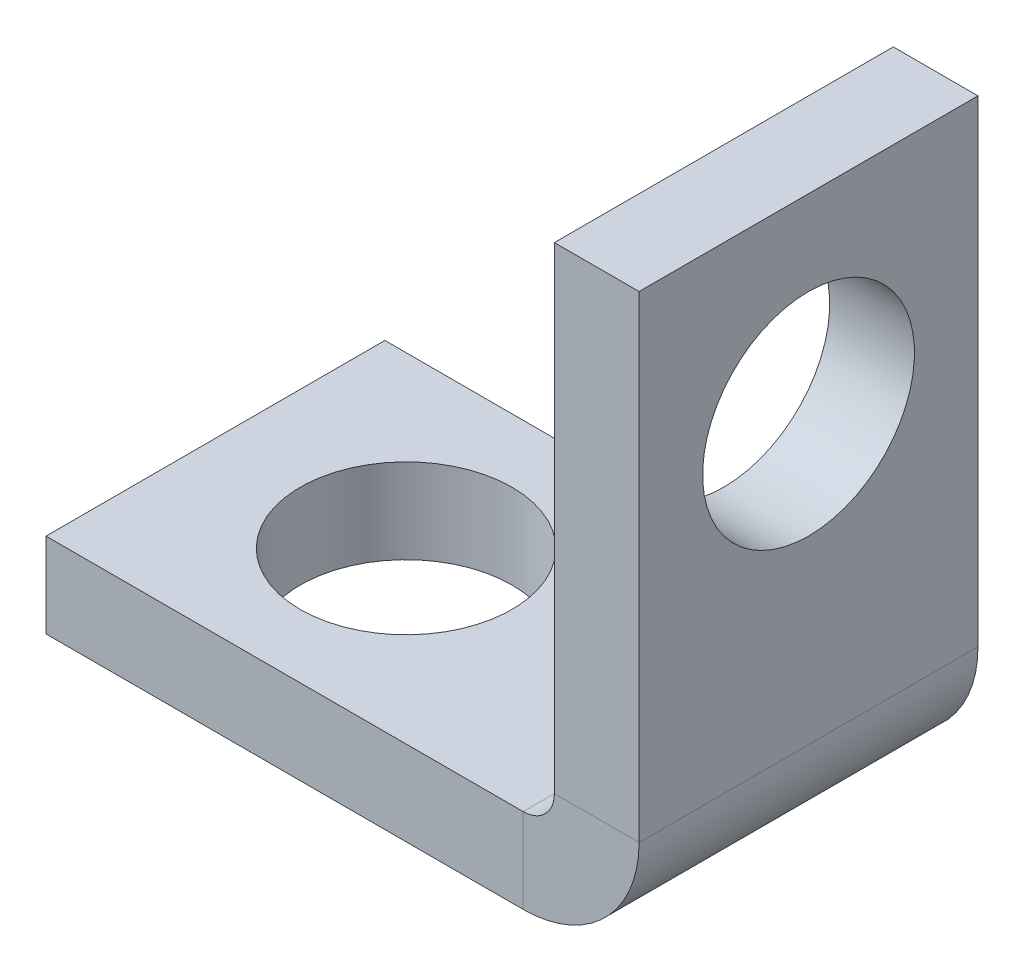
from build123d import *

# Parameters (mm, degrees)
SKETCH1_W                    = 14
SKETCH1_H                    = 8
SKETCH1_R                    = 2.5
BASE_FLANGE1_DEPTH           = 2
EDGE_FLANGE1_STRIP_W         = 9.4732
EDGE_FLANGE1_STRIP_H         = 2
EDGE_FLANGE1_STRIP_CUT_DEPTH = 8
EDGE_FLANGE1_DEPTH           = 8
EDGE_FLANGE1_PROFILE_W       = 8
EDGE_FLANGE1_PROFILE_H       = 11.2634
EDGE_FLANGE1_PROFILE_R       = 2.5
EDGE_FLANGE1_FLAT_DEPTH      = 2


# Sheet-metal steps are written as plain solids
with BuildPart() as part:
    # Sketch1 → Base-Flange1 (new body)
    with BuildSketch(Plane(origin=(0, 0, 0), x_dir=(1, 0, 0), z_dir=(0, 1, 0))):
        Rectangle(SKETCH1_W, SKETCH1_H)
        with Locations(Location((-2.5, 0, 0), (0, 0, 270))):
            Circle(SKETCH1_R, mode=Mode.SUBTRACT)
    extrude(amount=-BASE_FLANGE1_DEPTH)

    # Edge-Flange1 strip (across the edge) → Edge-Flange1 strip cut (cut)
    with BuildSketch(Plane(origin=(7, 0, 4), x_dir=(-1, 0, 0), z_dir=(0, 0, -1))):
        with Locations((-2, -1)):
            Rectangle(EDGE_FLANGE1_STRIP_W, EDGE_FLANGE1_STRIP_H)
    extrude(amount=EDGE_FLANGE1_STRIP_CUT_DEPTH, mode=Mode.SUBTRACT)

    # Edge-Flange1 bend section (across the edge) → Edge-Flange1 (add)
    with BuildSketch(Plane(origin=(7, 0, 4), x_dir=(-1, 0, 0), z_dir=(0, 0, -1))):
        with BuildLine():
            Line((0, 0.7366), (2, 0.7366))
            ThreePointArc((2, 0.7366), (2.215745145, 0.215745145), (2.7366, 0))
            Line((2.7366, 0), (2.7366, -2))
            ThreePointArc((2.7366, -2), (0.801531583, -1.198468417), (0, 0.7366))
        make_face()
    extrude(amount=EDGE_FLANGE1_DEPTH)

    # Edge-Flange1 profile (on flange) → Edge-Flange1 flat (add)
    with BuildSketch(Plane(origin=(7, 0, 0), x_dir=(0, 0, -1), z_dir=(1, 0, 0))):
        with Locations((0, 6.3683)):
            Rectangle(EDGE_FLANGE1_PROFILE_W, EDGE_FLANGE1_PROFILE_H)
        with Locations((0, 7.5)):
            Circle(EDGE_FLANGE1_PROFILE_R, mode=Mode.SUBTRACT)
    extrude(amount=-EDGE_FLANGE1_FLAT_DEPTH)


solid = part.part
